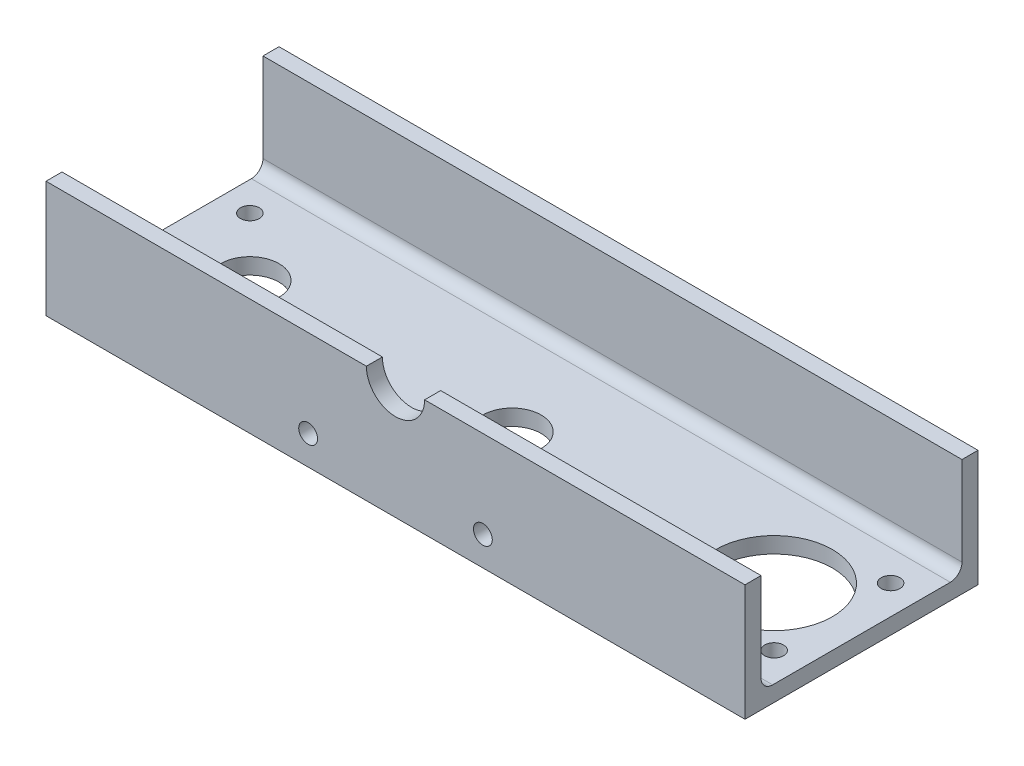
from build123d import *

# Parameters (mm, degrees)
BOSS_EXTRUDE1_DEPTH = 152.4
SKETCH2_R           = 6.35
SKETCH2_R_2         = 2.05
CUT_EXTRUDE1_DEPTH  = 6.35
SKETCH4_R           = 6.35
SKETCH4_R_2         = 12.7
SKETCH4_R_3         = 2.05
CUT_EXTRUDE2_DEPTH  = 6.35


with BuildPart() as part:
    # Sketch1 → Boss-Extrude1 (new body)
    with BuildSketch(Plane(origin=(0, 0, 0), x_dir=(0, 0, -1), z_dir=(1, 0, 0))):
        with BuildLine():
            Line((-21.9075, -6.6675), (-21.9075, 9.2075))
            Line((-21.9075, 9.2075), (-21.9075, 12.7))
            Line((-21.9075, 12.7), (-25.4, 12.7))
            Line((-25.4, 12.7), (-25.4, -12.7))
            Line((-25.4, -12.7), (25.4, -12.7))
            Line((25.4, -12.7), (25.4, 12.7))
            Line((25.4, 12.7), (21.9075, 12.7))
            Line((21.9075, 12.7), (21.9075, 9.2075))
            Line((21.9075, 9.2075), (21.9075, -6.6675))
            ThreePointArc((21.9075, -6.6675), (21.163551224, -8.463551224), (19.3675, -9.2075))
            Line((19.3675, -9.2075), (-19.3675, -9.2075))
            ThreePointArc((-19.3675, -9.2075), (-21.163551224, -8.463551224), (-21.9075, -6.6675))
        make_face()
    extrude(amount=-BOSS_EXTRUDE1_DEPTH)

    # Sketch2 → Cut-Extrude1 (cut)
    with BuildSketch(Plane.XY.offset(25.4)):
        with Locations((-76.2, 12.7)):
            Circle(SKETCH2_R)
        with Locations((-57.15, -6.35)):
            Circle(SKETCH2_R_2)
        with Locations((-95.25, -6.35)):
            Circle(SKETCH2_R_2)
    extrude(amount=-CUT_EXTRUDE1_DEPTH, mode=Mode.SUBTRACT)

    # Sketch4 → Cut-Extrude2 (cut)
    with BuildSketch(Plane.XZ.offset(12.7)):
        with Locations((-133.35, 0)):
            Circle(SKETCH4_R)
        with Locations((-76.2, 0)):
            Circle(SKETCH4_R)
        with Locations((-19.05, 0)):
            Circle(SKETCH4_R_2)
        with Locations((-146.05, 12.7)):
            Circle(SKETCH4_R_3)
        with Locations((-146.05, -12.7)):
            Circle(SKETCH4_R_3)
        with Locations((-6.35, -12.7)):
            Circle(SKETCH4_R_3)
        with Locations((-6.35, 12.7)):
            Circle(SKETCH4_R_3)
    extrude(amount=-CUT_EXTRUDE2_DEPTH, mode=Mode.SUBTRACT)


solid = part.part
